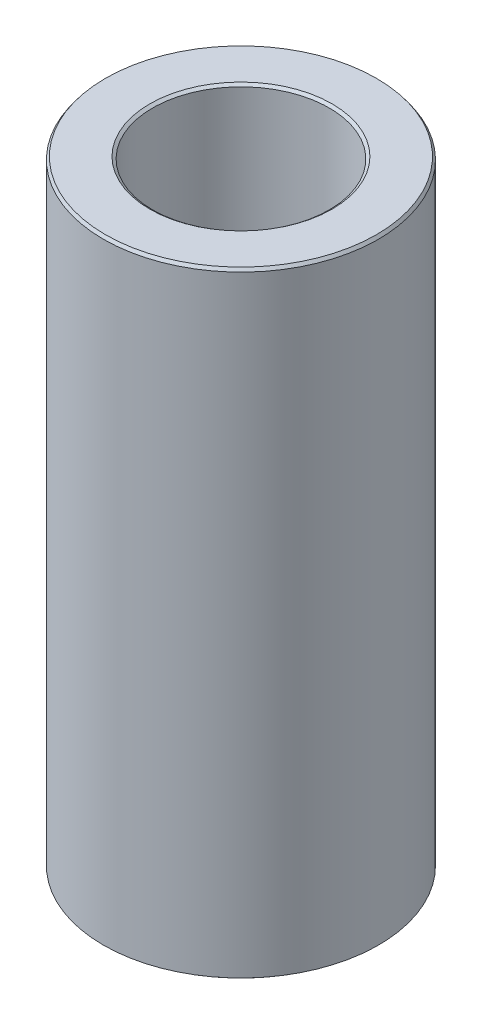
from build123d import *
from OCP.BRepFilletAPI import BRepFilletAPI_MakeChamfer

# Parameters (mm, degrees)
SKETCH1_R           = 37.5
BOSS_EXTRUDE1_DEPTH = 168.004298052
SKETCH2_R           = 24.075852311
CUT_EXTRUDE1_DEPTH  = 177.175889848
CHAMFER1_SIZE       = 0.784878224
CHAMFER1_SIZE2      = 0.570369101


with BuildPart() as part:
    # Sketch1 → Boss-Extrude1 (new body)
    with BuildSketch(Plane(origin=(0, 0, 0), x_dir=(1, 0, 0), z_dir=(0, 1, 0))):
        Circle(SKETCH1_R)
    extrude(amount=BOSS_EXTRUDE1_DEPTH)

    # Sketch2 → Cut-Extrude1 (cut, through all)
    with BuildSketch(Plane(origin=(0, 0, 0), x_dir=(1, 0, 0), z_dir=(0, 1, 0))):
        Circle(SKETCH2_R)
    extrude(amount=CUT_EXTRUDE1_DEPTH, mode=Mode.SUBTRACT)

    # Chamfer1: one chamfer whose edges measure the first distance from different faces: ONE call of the kernel's chamfer builder (chamfer() names one face for all edges)
    chamfer1_edges_1 = [part.edges().sort_by_distance(p)[0] for p in [
        (-24.075852311, 168.004298052, 0),
    ]]
    chamfer1_side_1 = [part.faces().sort_by_distance(p)[0] for p in [
        (-36.439339828, 168.004298052, 0),
    ]]
    chamfer1_edges_2 = [part.edges().sort_by_distance(p)[0] for p in [
        (-24.075852311, 0, 0),
    ]]
    chamfer1_side_2 = [part.faces().sort_by_distance(p)[0] for p in [
        (-24.075852311, 84.002149026, 0),
    ]]
    chamfer1_edges_3 = [part.edges().sort_by_distance(p)[0] for p in [
        (-37.5, 0, 0),
    ]]
    chamfer1_side_3 = [part.faces().sort_by_distance(p)[0] for p in [
        (-36.439339828, 0, 0),
    ]]
    chamfer1_edges_4 = [part.edges().sort_by_distance(p)[0] for p in [
        (-37.5, 168.004298052, 0),
    ]]
    chamfer1_side_4 = [part.faces().sort_by_distance(p)[0] for p in [
        (-37.5, 84.002149026, 0),
    ]]
    chamfer1 = BRepFilletAPI_MakeChamfer(part.part.solid().wrapped)
    for e in chamfer1_edges_1:
        chamfer1.Add(CHAMFER1_SIZE, CHAMFER1_SIZE2, e.wrapped, chamfer1_side_1[0].wrapped)  # the first distance lies on this face
    for e in chamfer1_edges_2:
        chamfer1.Add(CHAMFER1_SIZE, CHAMFER1_SIZE2, e.wrapped, chamfer1_side_2[0].wrapped)  # the first distance lies on this face
    for e in chamfer1_edges_3:
        chamfer1.Add(CHAMFER1_SIZE, CHAMFER1_SIZE2, e.wrapped, chamfer1_side_3[0].wrapped)  # the first distance lies on this face
    for e in chamfer1_edges_4:
        chamfer1.Add(CHAMFER1_SIZE, CHAMFER1_SIZE2, e.wrapped, chamfer1_side_4[0].wrapped)  # the first distance lies on this face
    add(Compound.cast(chamfer1.Shape()), mode=Mode.REPLACE)


solid = part.part
